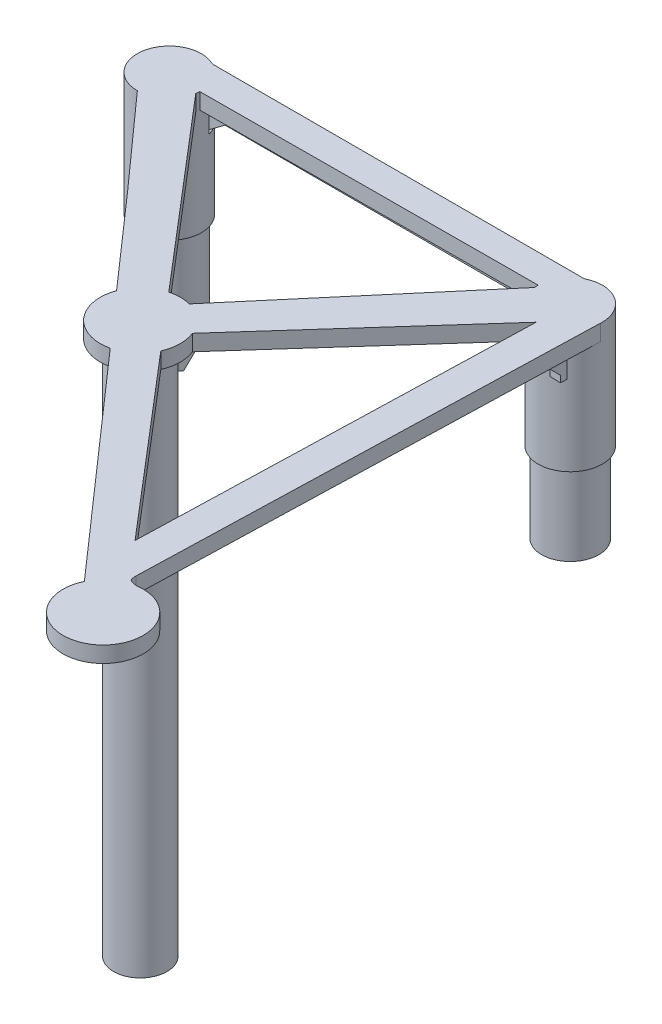
from build123d import *
from build123d.topology import SkipClean

# Parameters (mm, degrees)
EXTRUDE_1_DEPTH     = 3
SKETCH_2_R          = 5.35
EXTRUDE_2_DEPTH     = 23
CUT_EXTRUDE_1_DEPTH = 3
SKETCH_4_R          = 5
EXTRUDE_3_DEPTH     = 100
EXTRUDE_START       = 3
SKETCH_5_R          = 5
EXTRUDE_4_DEPTH     = 3
SKETCH_6_R          = 5.35
EXTRUDE_5_DEPTH     = 5
SKETCH_7_R          = 5.35
EXTRUDE_6_DEPTH     = 5
SKETCH_8_W          = 75
SKETCH_8_H          = 10.7
EXTRUDE_7_DEPTH     = 3
EXTRUDE_8_DEPTH     = 3
CUT_EXTRUDE_2_DEPTH = 3
SKETCH_12_R         = 6
EXTRUDE_10_DEPTH    = 13
SKETCH_13_R         = 3
CUT_EXTRUDE_3_DEPTH = 23
SKETCH_14_R         = 3.125
CUT_EXTRUDE_5_DEPTH = 100
SKETCH_15_R         = 6
SKETCH_15_R_2       = 5.35
EXTRUDE_11_DEPTH    = 5
SKETCH_16_R         = 6
SKETCH_16_R_2       = 3
EXTRUDE_12_DEPTH    = 5
SKETCH_17_R         = 5.35
SKETCH_17_R_2       = 3
EXTRUDE_13_DEPTH    = 5
SKETCH_18_R         = 5.35
SKETCH_18_R_2       = 3
EXTRUDE_14_DEPTH    = 5
SKETCH_20_R         = 6
SKETCH_20_R_2       = 5.35
EXTRUDE_15_DEPTH    = 5
SKETCH_21_R         = 6
SKETCH_21_R_2       = 5.35
EXTRUDE_16_DEPTH    = 5
SKETCH_22_R         = 5.35
SKETCH_22_R_2       = 3
EXTRUDE_17_DEPTH    = 5
SKETCH_23_R         = 5.35
SKETCH_23_R_2       = 3
EXTRUDE_18_DEPTH    = 5
SKETCH_25_R         = 7.5
EXTRUDE_20_DEPTH    = 3
EXTRUDE_21_DEPTH    = 3
EXTRUDE_23_DEPTH    = 3
SKETCH_30_R         = 7.5
EXTRUDE_24_DEPTH    = 3
FILLET_1_R          = 3
EXTRUDE_29_DEPTH    = 5
EXTRUDE_31_DEPTH    = 2


with BuildPart() as part:
    # 草图1 → 凸台-拉伸1 (new body)
    with BuildSketch(Plane(origin=(0, 0, 0), x_dir=(1, 0, 0), z_dir=(0, 1, 0))):
        Polygon((-18.65535641, 0), (18.84464359, -42.930983399), (56.34464359, 0), align=None)
    extrude(amount=EXTRUDE_1_DEPTH)

    # 草图2 → 凸台-拉伸2 (add)
    with BuildSketch(Plane(origin=(0, 3, 0), x_dir=(1, 0, 0), z_dir=(0, 1, 0))):
        with Locations(Location((56.34464359, 0, 0), (0, 0, 270))):
            Circle(SKETCH_2_R)
        with Locations(Location((-18.65535641, 0, 0), (0, 0, 270))):
            Circle(SKETCH_2_R)
    extrude(amount=-EXTRUDE_2_DEPTH)

    # 草图3 → 切除-拉伸1 (cut)
    with BuildSketch(Plane.XZ):
        Polygon((8.632668758, 17.559374543), (1.15609776, 9), (33.75905687, 9), (36.53318942, 9), (29.056618422, 17.559374543), (18.84464359, 29.25031113), align=None)
    extrude(amount=-CUT_EXTRUDE_1_DEPTH, mode=Mode.SUBTRACT)

    # 草图4 → 凸台-拉伸3 (add)
    with BuildSketch(Plane.XZ):
        with Locations(Location((18.84464359, 42.930983399, 0), (0, 0, 228.862949093))):
            Circle(SKETCH_4_R)
    extrude(amount=EXTRUDE_3_DEPTH)

    # 草图5 → 凸台-拉伸4 (add)
    with BuildSketch(Plane(origin=(0, 0, 0), x_dir=(1, 0, 0), z_dir=(0, 1, 0)).offset(EXTRUDE_START)):
        with Locations(Location((18.84464359, -42.930983399, 0), (0, 0, 131.137050907))):
            Circle(SKETCH_5_R)
    extrude(amount=-EXTRUDE_4_DEPTH)

    # 草图6 → 凸台-拉伸5 (add)
    with SkipClean():  # the faces are left unmerged after this step: merging them gives an invalid solid
        with BuildSketch(Plane.XZ.offset(20)):
            with Locations(Location((56.34464359, 0, 0), (0, 0, 131.137050907))):
                Circle(SKETCH_6_R)
        extrude(amount=EXTRUDE_5_DEPTH)
    add(part.part.scale(1), mode=Mode.REPLACE)  # the faces are merged on a copy

    # 草图7 → 凸台-拉伸6 (add)
    with BuildSketch(Plane.XZ.offset(20)):
        with Locations(Location((-18.65535641, 0, 0), (0, 0, 48.862949093))):
            Circle(SKETCH_7_R)
    extrude(amount=EXTRUDE_6_DEPTH)

    # 草图8 → 凸台-拉伸7 (add)
    with SkipClean():  # the faces are left unmerged after this step: merging them gives an invalid solid
        with BuildSketch(Plane(origin=(0, 3, 0), x_dir=(1, 0, 0), z_dir=(0, 1, 0))):
            with Locations((18.84464359, 0)):
                Rectangle(SKETCH_8_W, SKETCH_8_H)
        extrude(amount=-EXTRUDE_7_DEPTH)

    # 草图9 → 凸台-拉伸8 (add)
    with SkipClean():  # the faces are left unmerged after this step: merging them gives an invalid solid
        with BuildSketch(Plane(origin=(0, 3, 0), x_dir=(1, 0, 0), z_dir=(0, 1, 0))):
            Polygon((61.69464359, 0), (18.84464359, -47.930983399), (-24.00535641, 0), align=None)
        extrude(amount=-EXTRUDE_8_DEPTH)

    # 草图10 → 切除-拉伸2 (cut)
    with SkipClean():  # the faces are left unmerged after this step: merging them gives an invalid solid
        with BuildSketch(Plane.XZ):
            Polygon((18.84464359, 37.930983399), (-13.313716495, 0.298969924), (50.99464359, 0), align=None)
        extrude(amount=-CUT_EXTRUDE_2_DEPTH, mode=Mode.SUBTRACT)

    # 草图12 → 凸台-拉伸10 (add)
    with SkipClean():  # the faces are left unmerged after this step: merging them gives an invalid solid
        with BuildSketch(Plane(origin=(0, 3, 0), x_dir=(1, 0, 0), z_dir=(0, 1, 0))):
            with Locations(Location((-18.65535641, 0, 0), (0, 0, 270))):
                Circle(SKETCH_12_R)
            with Locations(Location((56.34464359, 0, 0), (0, 0, 270))):
                Circle(SKETCH_12_R)
        extrude(amount=-EXTRUDE_10_DEPTH)

    # 草图13 → 切除-拉伸3 (cut)
    with SkipClean():  # the faces are left unmerged after this step: merging them gives an invalid solid
        with BuildSketch(Plane.XZ.offset(25)):
            with Locations(Location((-18.65535641, 0, 0), (0, 0, 270))):
                Circle(SKETCH_13_R)
            with Locations(Location((56.34464359, 0, 0), (0, 0, 270))):
                Circle(SKETCH_13_R)
        extrude(amount=-CUT_EXTRUDE_3_DEPTH, mode=Mode.SUBTRACT)

    # 草图14 → 切除-拉伸5 (cut)
    with SkipClean():  # the faces are left unmerged after this step: merging them gives an invalid solid
        with BuildSketch(Plane.XZ.offset(100)):
            with Locations(Location((18.84464359, 42.930983399, 0), (0, 0, 270))):
                Circle(SKETCH_14_R)
        extrude(amount=-CUT_EXTRUDE_5_DEPTH, mode=Mode.SUBTRACT)

    # 草图15 → 凸台-拉伸11 (add)
    with SkipClean():  # the faces are left unmerged after this step: merging them gives an invalid solid
        with BuildSketch(Plane.XZ.offset(10)):
            with Locations(Location((56.34464359, 0, 0), (0, 0, 90.133194259))):
                Circle(SKETCH_15_R)
            with Locations(Location((56.34464359, 0, 0), (0, 0, 270))):
                Circle(SKETCH_15_R_2, mode=Mode.SUBTRACT)
        extrude(amount=EXTRUDE_11_DEPTH)

    # 草图16 → 凸台-拉伸12 (add)
    with SkipClean():  # the faces are left unmerged after this step: merging them gives an invalid solid
        with BuildSketch(Plane.XZ.offset(10)):
            with Locations(Location((-18.65535641, 0, 0), (0, 0, 89.866805741))):
                Circle(SKETCH_16_R)
            with Locations(Location((-18.65535641, 0, 0), (0, 0, 270))):
                Circle(SKETCH_16_R_2, mode=Mode.SUBTRACT)
        extrude(amount=EXTRUDE_12_DEPTH)

    # 草图17 → 凸台-拉伸13 (add)
    with SkipClean():  # the faces are left unmerged after this step: merging them gives an invalid solid
        with BuildSketch(Plane.XZ.offset(25)):
            with Locations(Location((-18.65535641, 0, 0), (0, 0, 270))):
                Circle(SKETCH_17_R)
            with Locations(Location((-18.65535641, 0, 0), (0, 0, 270))):
                Circle(SKETCH_17_R_2, mode=Mode.SUBTRACT)
        extrude(amount=EXTRUDE_13_DEPTH)

    # 草图18 → 凸台-拉伸14 (add)
    with SkipClean():  # the faces are left unmerged after this step: merging them gives an invalid solid
        with BuildSketch(Plane.XZ.offset(25)):
            with Locations(Location((56.34464359, 0, 0), (0, 0, 270))):
                Circle(SKETCH_18_R)
            with Locations(Location((56.34464359, 0, 0), (0, 0, 270))):
                Circle(SKETCH_18_R_2, mode=Mode.SUBTRACT)
        extrude(amount=EXTRUDE_14_DEPTH)

    # 草图20 → 凸台-拉伸15 (add)
    with SkipClean():  # the faces are left unmerged after this step: merging them gives an invalid solid
        with BuildSketch(Plane.XZ.offset(15)):
            with Locations(Location((-18.65535641, 0, 0), (0, 0, 89.866805741))):
                Circle(SKETCH_20_R)
            with Locations(Location((-18.65535641, 0, 0), (0, 0, 270))):
                Circle(SKETCH_20_R_2, mode=Mode.SUBTRACT)
        extrude(amount=EXTRUDE_15_DEPTH)

    # 草图21 → 凸台-拉伸16 (add)
    with SkipClean():  # the faces are left unmerged after this step: merging them gives an invalid solid
        with BuildSketch(Plane.XZ.offset(15)):
            with Locations(Location((56.34464359, 0, 0), (0, 0, 90.133194259))):
                Circle(SKETCH_21_R)
            with Locations(Location((56.34464359, 0, 0), (0, 0, 270))):
                Circle(SKETCH_21_R_2, mode=Mode.SUBTRACT)
        extrude(amount=EXTRUDE_16_DEPTH)

    # 草图22 → 凸台-拉伸17 (add)
    with SkipClean():  # the faces are left unmerged after this step: merging them gives an invalid solid
        with BuildSketch(Plane.XZ.offset(30)):
            with Locations(Location((-18.65535641, 0, 0), (0, 0, 270))):
                Circle(SKETCH_22_R)
            with Locations(Location((-18.65535641, 0, 0), (0, 0, 270))):
                Circle(SKETCH_22_R_2, mode=Mode.SUBTRACT)
        extrude(amount=EXTRUDE_17_DEPTH)

    # 草图23 → 凸台-拉伸18 (add)
    with SkipClean():  # the faces are left unmerged after this step: merging them gives an invalid solid
        with BuildSketch(Plane.XZ.offset(30)):
            with Locations(Location((56.34464359, 0, 0), (0, 0, 270))):
                Circle(SKETCH_23_R)
            with Locations(Location((56.34464359, 0, 0), (0, 0, 270))):
                Circle(SKETCH_23_R_2, mode=Mode.SUBTRACT)
        extrude(amount=EXTRUDE_18_DEPTH)

    # 草图25 → 凸台-拉伸20 (add)
    with SkipClean():  # the faces are left unmerged after this step: merging them gives an invalid solid
        with BuildSketch(Plane(origin=(0, 3, 0), x_dir=(1, 0, 0), z_dir=(0, 1, 0))):
            with Locations((18.84464359, -42.930983399)):
                Circle(SKETCH_25_R)
        extrude(amount=-EXTRUDE_20_DEPTH)

    # 草图28 → 凸台-拉伸21 (add)
    with SkipClean():  # the faces are left unmerged after this step: merging them gives an invalid solid
        with BuildSketch(Plane(origin=(0, 3, 0), x_dir=(1, 0, 0), z_dir=(0, 1, 0))):
            Polygon((-3.379636645, -23.071435978), (2.093554995, -18.328702995), (68.652557408, -96.216669577), (66.868599364, -97.910067347), (64.321605904, -100.026810209), align=None)
        extrude(amount=-EXTRUDE_21_DEPTH)

    # 草图29 → 凸台-拉伸23 (add)
    with SkipClean():  # the faces are left unmerged after this step: merging them gives an invalid solid
        with BuildSketch(Plane(origin=(0, 3, 0), x_dir=(1, 0, 0), z_dir=(0, 1, 0))):
            Polygon((56.34464359, 0), (53.74105837, -88), (59.74105837, -88), (62.34464359, 0), align=None)
        extrude(amount=-EXTRUDE_23_DEPTH)

    # 草图30 → 凸台-拉伸24 (add)
    with SkipClean():  # the faces are left unmerged after this step: merging them gives an invalid solid
        with BuildSketch(Plane(origin=(0, 3, 0), x_dir=(1, 0, 0), z_dir=(0, 1, 0))):
            with Locations((62.6531538, -93.694621783)):
                Circle(SKETCH_30_R)
        extrude(amount=-EXTRUDE_24_DEPTH)

    # 圆角1
    # the kernel refuses this fillet: 3 mm, written as the material it adds along each edge
    with BuildSketch(Plane(origin=(60.387632696, 0, 86.544977448), x_dir=(-0.6496534253779116, 0, -0.760230509052844), z_dir=(0, 1, 0))) as fillet_1_piece_1:
        with BuildLine():
            CenterArc((1.763131122, -3), FILLET_1_R, 90, 55.663998218)
            ThreePointArc((-0.714100998, -1.307864951), (-0.324488751, -0.671711358), (0, 0))
            Line((0, 0), (1.763131122, 0))
        make_face()
    extrude(amount=3)
    with BuildSketch(Plane(origin=(59.804303017, 0, 85.862359607), x_dir=(0.02957325513951661, 0, -0.9995626156376863), z_dir=(0, 1, 0))) as fillet_1_piece_2:
        with BuildLine():
            CenterArc((FILLET_1_R * 0.38596961824, -FILLET_1_R), FILLET_1_R, 90, 42.210146514)
            Line((-FILLET_1_R * 0.285882149698, -FILLET_1_R * 0.259314370385), (0, 0))
            Line((0, 0), (FILLET_1_R * 0.38596961824, 0))
        make_face()
    extrude(amount=3)

    # 草图31 → 凸台-拉伸29 (add)
    with BuildSketch(Plane.XZ):
        Polygon((-14.723586471, -1.628179316), (-14.723586471, -3.628179316), (53.527409972, -3.628179316), (53.82491501, -1.628179316), align=None)
        Polygon((49.609847968, 80.102545011), (51.130308987, 78.80323816), (22.318773999, 45.087710689), (20.798312981, 46.38701754), align=None)
        Polygon((-15.349607435, 4.086383285), (-13.829146417, 2.787076434), (17.097273349, 38.977461836), (15.576812331, 40.276768687), align=None)
        Polygon((20.325894576, 39.186783249), (51.86894969, 1.971881231), (53.394639731, 3.265043982), (21.851584617, 40.479945999), align=None)
        Polygon((56.093860655, 78.864293565), (58.318881117, 3.659610745), (60.319756269, 3.659610745), (58.092985887, 78.923440075), align=None)
    extrude(amount=EXTRUDE_29_DEPTH)

    # 切除-扫描1: sweep along a path in 草图36
    with BuildLine(Plane.XZ.offset(5)) as sweep_1_path:
        Line((18.84464359, -3.628179316), (18.84464359, -1.628179316))
    # 草图35 → 切除-扫描1 (sweep, cut)
    with BuildSketch(Plane(origin=(0, 0, -3.628179316), x_dir=(-1, 0, 0), z_dir=(0, 0, -1))):
        Polygon((13.876620714, -5), (9.876620714, -2), (-47.565907894, -2), (-51.565907894, -5), align=None)
    sweep(path=sweep_1_path.line, mode=Mode.SUBTRACT)

    # 切除-扫描3: sweep along a path in 草图38
    with BuildLine(Plane.XZ.offset(5)) as sweep_3_path:
        Line((59.19369399, 41.720005215), (57.192818839, 41.720005215))
    # 草图37 → 切除-扫描3 (sweep, cut)
    with BuildSketch(Plane(origin=(60.375181238, 0, 1.786271926), x_dir=(0.029573255139513054, 0, -0.9995626156376864), z_dir=(0.9995626156376866, 0, 0.029573255139513057))):
        Polygon((-2.73149314, -5), (-6.73149314, -1), (-73.170921503, -1), (-77.170921503, -5), align=None)
    sweep(path=sweep_3_path.line, mode=Mode.SUBTRACT)

    # 草图39 → 凸台-拉伸31 (add)
    with BuildSketch(Plane(origin=(58.376056006, 0, 1.727125416), x_dir=(0.02957325513951297, 0, -0.9995626156376864), z_dir=(0.9995626156376866, 0, 0.029573255139512974))):
        Polygon((-3.961044, -3.829621531), (-3.961044, -5), (-2.73149314, -5), (-2.73149314, -4.501704435), (-3.961044, -3.272153575), align=None)
    extrude(amount=EXTRUDE_31_DEPTH)

    # 切除-扫描5: sweep along a path in 草图42
    with BuildLine(Plane.XZ.offset(5)) as sweep_5_path:
        Line((0.095091388, 22.159914171), (1.552120507, 20.786378718))
    # 草图40 → 切除-扫描5 (sweep, cut)
    with BuildSketch(Plane(origin=(-10.889521113, 0, 9.305617977), x_dir=(0.6496534253779145, 0, 0.7602305090528415), z_dir=(-0.7602305090528415, 0, 0.6496534253779145))):
        Polygon((-5.121187346, -5), (-3.121187346, -1), (36.9380259, -1), (38.9380259, -5), align=None)
    sweep(path=sweep_5_path.line, mode=Mode.SUBTRACT)

    # 切除-扫描6: sweep along a path in 草图44
    with BuildLine(Plane.XZ.offset(5)) as sweep_6_path:
        Line((36.035656698, 20.652203895), (37.472857905, 22.049766909))
    # 草图43 → 切除-扫描6 (sweep, cut)
    with BuildSketch(Plane(origin=(31.1568423, 0, 26.408291855), x_dir=(-0.6465813751887421, 0, 0.7628450204720715), z_dir=(-0.7628450204720715, 0, -0.6465813751887421))):
        Polygon((14.734624595, -5), (12.734624595, -1), (-27.825731715, -1), (-29.825731715, -5), align=None)
    sweep(path=sweep_6_path.line, mode=Mode.SUBTRACT)

    # 切除-扫描7: sweep along a path in 草图47
    with BuildLine(Plane.XZ.offset(5)) as sweep_7_path:
        Line((37.03221924, 62.305521799), (35.511758222, 63.60482865))
    # 草图46 → 切除-扫描7 (sweep, cut)
    with BuildSketch(Plane(origin=(-10.889521113, 0, 9.305617977), x_dir=(0.6496534253779142, 0, 0.7602305090528417), z_dir=(-0.7602305090528417, 0, 0.6496534253779142))):
        Polygon((50.821835343, -5), (52.821835343, -1), (88.125606235, -1), (93.125606235, 0), (93.125606235, -5), align=None)
    sweep(path=sweep_7_path.line, mode=Mode.SUBTRACT)

    # 切除-扫描8: sweep along a path in 草图49
    with BuildLine(Plane.XZ.offset(1)) as sweep_8_path:
        Line((58.211278907, 74.925189613), (56.210403756, 74.925189613))
        Line((56.210403756, 74.925189613), (55.379994456, 74.925189613))
    # 草图48 → 切除-扫描8 (sweep, cut)
    with BuildSketch(Plane(origin=(60.375181238, 0, 1.786271926), x_dir=(0.029573255139513054, 0, -0.9995626156376864), z_dir=(0.9995626156376866, 0, 0.029573255139513057))):
        Polygon((-73.170921503, -1), (-77.170921503, 0), (-77.170921503, -5), align=None)
    sweep(path=sweep_8_path.line, mode=Mode.SUBTRACT)


solid = part.part
